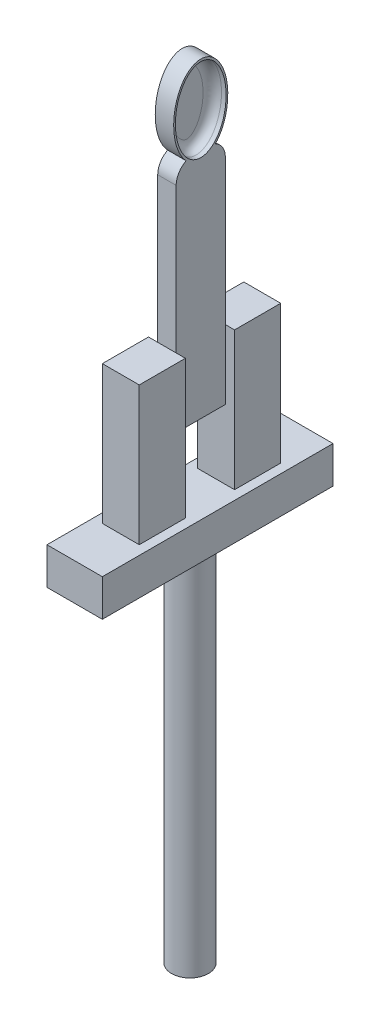
from build123d import *

# Parameters (mm, degrees)
SKETCH1_R                = 10
BOSS_EXTRUDE1_DEPTH      = 200
BOSS_EXTRUDE2_DEPTH      = 15
BOSS_EXTRUDE2_DEPTH_BACK = 15
SKETCH2_W                = 125
SKETCH2_H                = 20
BOSS_EXTRUDE3_DEPTH      = 10
BOSS_EXTRUDE3_DEPTH_BACK = 10
SKETCH3_W                = 25
SKETCH3_H                = 75
BOSS_EXTRUDE4_DEPTH      = 5
BOSS_EXTRUDE4_DEPTH_BACK = 5
SKETCH5_W                = 26.648824617
SKETCH5_H                = 125
BOSS_EXTRUDE5_DEPTH      = 5
BOSS_EXTRUDE5_DEPTH_BACK = 5
SKETCH6_RX               = 23.77956847
SKETCH6_RY               = 14.659300575
FILLET1_R                = 10
FILLET2_R                = 10
SKETCH7_RX               = 22.5
SKETCH7_RY               = 13.75
CUT_EXTRUDE1_DEPTH       = 7.5
FILLET3_R                = 5


with BuildPart() as part:
    # Sketch1 → Boss-Extrude1 (new body)
    with BuildSketch(Plane(origin=(0, 0, 0), x_dir=(1, 0, 0), z_dir=(0, 1, 0))):
        with Locations(Location((0, 0, 0), (0, 0, 270))):
            Circle(SKETCH1_R)
    extrude(amount=BOSS_EXTRUDE1_DEPTH)

    # Sketch2 → Boss-Extrude2 (add, two sides: drawn at the far end of the back side and taken through both)
    with BuildSketch(Plane(origin=(0, 0, 0), x_dir=(0, 0, -1), z_dir=(1, 0, 0)).offset(-BOSS_EXTRUDE2_DEPTH_BACK)):
        with Locations((0, 210)):
            Rectangle(SKETCH2_W, SKETCH2_H)
    extrude(amount=BOSS_EXTRUDE2_DEPTH + BOSS_EXTRUDE2_DEPTH_BACK)

    # Sketch3 → Boss-Extrude3 (add, two sides: drawn at the far end of the back side and taken through both)
    with BuildSketch(Plane(origin=(0, 0, 0), x_dir=(0, 0, -1), z_dir=(1, 0, 0)).offset(-BOSS_EXTRUDE3_DEPTH_BACK)):
        with Locations((-25, 257.5)):
            Rectangle(SKETCH3_W, SKETCH3_H)
        with Locations((26.648824617, 257.5)):
            Rectangle(SKETCH3_W, SKETCH3_H)
    extrude(amount=BOSS_EXTRUDE3_DEPTH + BOSS_EXTRUDE3_DEPTH_BACK)

    # Sketch5 → Boss-Extrude4 (add, two sides: drawn at the far end of the back side and taken through both)
    with BuildSketch(Plane(origin=(0, 0, 0), x_dir=(0, 0, -1), z_dir=(1, 0, 0)).offset(-BOSS_EXTRUDE4_DEPTH_BACK)):
        with Locations((0.824412309, 320)):
            Rectangle(SKETCH5_W, SKETCH5_H)
    extrude(amount=BOSS_EXTRUDE4_DEPTH + BOSS_EXTRUDE4_DEPTH_BACK)

    # Sketch6 → Boss-Extrude5 (add, two sides: drawn at the far end of the back side and taken through both)
    with BuildSketch(Plane(origin=(0, 0, 0), x_dir=(0, 0, -1), z_dir=(1, 0, 0)).offset(-BOSS_EXTRUDE5_DEPTH_BACK)):
        with Locations(Location((0.824412308, 402.5), (0, 0, -90))):
            Ellipse(SKETCH6_RX, SKETCH6_RY)
    extrude(amount=BOSS_EXTRUDE5_DEPTH + BOSS_EXTRUDE5_DEPTH_BACK)

    # Fillet1
    # the kernel refuses this fillet: 10 mm, written as the material it takes off along each edge
    with BuildSketch(Plane(origin=(-27.190897542, 382.5, -14.148824617), x_dir=(0, 0, 1), z_dir=(1, 0, 0))) as fillet1_piece_1:
        with BuildLine():
            CenterArc((10, 8.876359017), FILLET1_R, 180, 62.577662354)
            Line((0, 8.876359017), (0, 0))
            Line((0, 0), (5.394541216, 0))
        make_face()
    extrude(amount=27.190898125, mode=Mode.SUBTRACT)
    with BuildSketch(Plane(origin=(5.84e-07, 382.5, -14.148824617), x_dir=(0, 0, 1), z_dir=(1, 0, 0))) as fillet1_piece_2:
        with BuildLine():
            CenterArc((10, 8.876359017), FILLET1_R, 180, 62.577662354)
            Line((0, 8.876359017), (0, 0))
            Line((0, 0), (5.394541216, 0))
        make_face()
    extrude(amount=27.190896958, mode=Mode.SUBTRACT)

    # Fillet2
    # the kernel refuses this fillet: 10 mm, written as the material it takes off along each edge
    with BuildSketch(Plane(origin=(27.190897542, 382.5, 12.5), x_dir=(0, 0, -1), z_dir=(-1, 0, 0))) as fillet2_piece_1:
        with BuildLine():
            CenterArc((10, 8.876359017), FILLET2_R, 180, 62.577662355)
            Line((0, 8.876359017), (0, 0))
            Line((0, 0), (5.394541216, 0))
        make_face()
    extrude(amount=27.190896946, mode=Mode.SUBTRACT)
    with BuildSketch(Plane(origin=(5.96e-07, 382.5, 12.5), x_dir=(0, 0, -1), z_dir=(-1, 0, 0))) as fillet2_piece_2:
        with BuildLine():
            CenterArc((10, 8.876359017), FILLET2_R, 180, 62.577662354)
            Line((0, 8.876359017), (0, 0))
            Line((0, 0), (5.394541216, 0))
        make_face()
    extrude(amount=27.190898138, mode=Mode.SUBTRACT)

    # Sketch7 → Cut-Extrude1 (cut)
    with BuildSketch(Plane(origin=(5, 0, 0), x_dir=(0, 0, -1), z_dir=(1, 0, 0))):
        with Locations(Location((0.824412308, 402.5), (0, 0, 90))):
            Ellipse(SKETCH7_RX, SKETCH7_RY)
    extrude(amount=-CUT_EXTRUDE1_DEPTH, mode=Mode.SUBTRACT)

    # Fillet3
    fillet3_edges = [part.edges().sort_by_distance(p)[0] for p in [
        (-2.5, 380.000046084, -0.852241692),
    ]]
    fillet(fillet3_edges, radius=FILLET3_R)


solid = part.part
